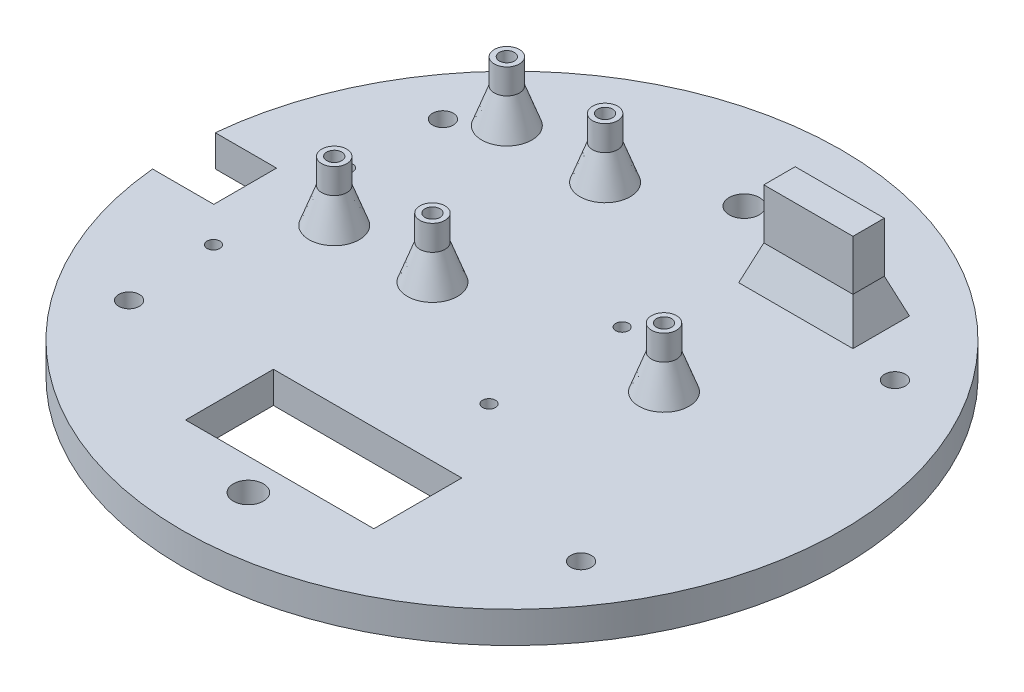
from build123d import *

# Parameters (mm, degrees)
SKETCH2_R                 = 52.5
SKETCH2_W                 = 30
SKETCH2_H                 = 14
BOSS_EXTRUDE1_DEPTH       = 5
SKETCH15_R                = 2
BOSS_EXTRUDE3_DEPTH       = 9.5
SKETCH17_R                = 2
SKETCH17_W                = 14.2
SKETCH17_H                = 5
BOSS_EXTRUDE4_DEPTH       = 9.5
M2_CLEARANCE_HOLE2_D      = 2.4
M2_CLEARANCE_HOLE2_DEPTH  = 9.5
SKETCH19_W                = 14.2
SKETCH19_H                = 5
BOSS_EXTRUDE5_DEPTH       = 4
SKETCH21_W                = 10
SKETCH21_H                = 10
CUT_EXTRUDE1_DEPTH        = 76.463567369
M4_CLEARANCE_HOLE2_D      = 4.8
TAP_DRILL_FOR_M4_TAP1_D   = 3.3
TAP_DRILL_FOR_M2_5_TAP2_D = 2.05
CHAMFER1_SIZE             = 2
CHAMFER1_SIZE2            = 5.494954839
M2_CLEARANCE_HOLE1_D      = 2.4
M2_CLEARANCE_HOLE1_DEPTH  = 9.5
SKETCH54_R                = 0.8
CUT_EXTRUDE2_DEPTH        = 76.463567369
SKETCH56_R                = 0.8
CUT_EXTRUDE3_DEPTH        = 76.463567369


with BuildPart() as part:
    # Sketch2 → Boss-Extrude1 (new body)
    with BuildSketch(Plane(origin=(0, 0, 0), x_dir=(1, 0, 0), z_dir=(0, 1, 0))):
        Circle(SKETCH2_R)
        with Locations((0, -30)):
            Rectangle(SKETCH2_W, SKETCH2_H, mode=Mode.SUBTRACT)
    extrude(amount=BOSS_EXTRUDE1_DEPTH)

    # Sketch15 → Boss-Extrude3 (add)
    with BuildSketch(Plane(origin=(0, 5, 0), x_dir=(1, 0, 0), z_dir=(0, 1, 0))):
        with Locations((-30.02607336, 29.209873591)):
            Circle(SKETCH15_R)
        with Locations((-14.37607336, 29.209873591)):
            Circle(SKETCH15_R)
        with Locations((-14.37607336, 1.709873591)):
            Circle(SKETCH15_R)
        with Locations((-30.02607336, 1.709873591)):
            Circle(SKETCH15_R)
    extrude(amount=BOSS_EXTRUDE3_DEPTH)

    # Sketch17 → Boss-Extrude4 (add)
    with BuildSketch(Plane(origin=(0, 5, 0), x_dir=(1, 0, 0), z_dir=(0, 1, 0))):
        with Locations((19.217395201, 5)):
            Circle(SKETCH17_R)
        with Locations((19.217395201, 30.5)):
            Rectangle(SKETCH17_W, SKETCH17_H)
    extrude(amount=BOSS_EXTRUDE4_DEPTH)

    # M2 Clearance Hole2
    with Locations(Plane(origin=(19.217395201, 14.5, -5), x_dir=(0, 0, 1), z_dir=(0, 1, 0))):
        with Locations((0, 0)):
            Hole(M2_CLEARANCE_HOLE2_D / 2, depth=M2_CLEARANCE_HOLE2_DEPTH)

    # Sketch19 → Boss-Extrude5 (add)
    with BuildSketch(Plane(origin=(0, 14.5, 0), x_dir=(1, 0, 0), z_dir=(0, 1, 0))):
        with Locations((19.217395201, 30.5)):
            Rectangle(SKETCH19_W, SKETCH19_H)
    extrude(amount=BOSS_EXTRUDE5_DEPTH)

    # Sketch21 → Cut-Extrude1 (cut, through all)
    with BuildSketch(Plane(origin=(0, 5, 0), x_dir=(1, 0, 0), z_dir=(0, 1, 0))):
        with Locations((-47.5, 0)):
            Rectangle(SKETCH21_W, SKETCH21_H)
    extrude(amount=-CUT_EXTRUDE1_DEPTH, mode=Mode.SUBTRACT)

    # M4 Clearance Hole2 (through all)
    with Locations(Plane(origin=(0, 0, 42), x_dir=(0, 0, -1), z_dir=(0, -1, 0))):
        with Locations((0, 0), (79, 0)):
            Hole(M4_CLEARANCE_HOLE2_D / 2)

    # Tap Drill for M4 Tap1 (through all)
    with Locations(Plane(origin=(-36, 0, 25), x_dir=(0, 0, -1), z_dir=(0, -1, 0))):
        with Locations((0, 0), (0, 72), (50, 72), (50, 0)):
            Hole(TAP_DRILL_FOR_M4_TAP1_D / 2)

    # Tap Drill for M2.5 Tap2 (through all)
    with Locations(Plane(origin=(-36.95, 0, 10.6), x_dir=(0, 0, -1), z_dir=(0, -1, 0))):
        with Locations((0, 0), (0, 43.9), (21.2, 43.9), (21.2, 0)):
            Hole(TAP_DRILL_FOR_M2_5_TAP2_D / 2)

    # Chamfer1
    chamfer1_edges = [part.edges().sort_by_distance(p)[0] for p in [
        (17.217395201, 5, -5),
        (19.217395201, 5, -28),
        (12.117395201, 5, -30.5),
        (26.317395201, 5, -30.5),
        (19.217395201, 5, -33),
        (-16.37607336, 5, -1.709873591),
        (-16.37607336, 5, -29.209873591),
        (-32.02607336, 5, -29.209873591),
        (-32.02607336, 5, -1.709873591),
    ]]
    chamfer1_side = [part.faces().sort_by_distance(p)[0] for p in [
        (0.557458192, 5, -1.222493467),
    ]]
    chamfer(chamfer1_edges, length=CHAMFER1_SIZE, length2=CHAMFER1_SIZE2, reference=chamfer1_side[0])

    # M2 Clearance Hole1
    with Locations(Plane(origin=(-30.02607336, 14.5, -29.209873591), x_dir=(0, 0, 1), z_dir=(0, 1, 0))):
        with Locations((0, 0), (0, 15.65), (27.5, 15.65), (27.5, 0)):
            Hole(M2_CLEARANCE_HOLE1_D / 2, depth=M2_CLEARANCE_HOLE1_DEPTH)

    # Sketch54 → Cut-Extrude2 (cut, through all)
    with BuildSketch(Plane(origin=(0, 5, 0), x_dir=(1, 0, 0), z_dir=(0, 1, 0))):
        with Locations((-30.02607336, 29.209873591)):
            Circle(SKETCH54_R)
        with Locations((-14.37607336, 29.209873591)):
            Circle(SKETCH54_R)
        with Locations((-14.37607336, 1.709873591)):
            Circle(SKETCH54_R)
        with Locations((-30.02607336, 1.709873591)):
            Circle(SKETCH54_R)
    extrude(amount=-CUT_EXTRUDE2_DEPTH, mode=Mode.SUBTRACT)

    # Sketch56 → Cut-Extrude3 (cut, through all)
    with BuildSketch(Plane(origin=(0, 5, 0), x_dir=(1, 0, 0), z_dir=(0, 1, 0))):
        with Locations((19.217395201, 5)):
            Circle(SKETCH56_R)
    extrude(amount=-CUT_EXTRUDE3_DEPTH, mode=Mode.SUBTRACT)


solid = part.part
